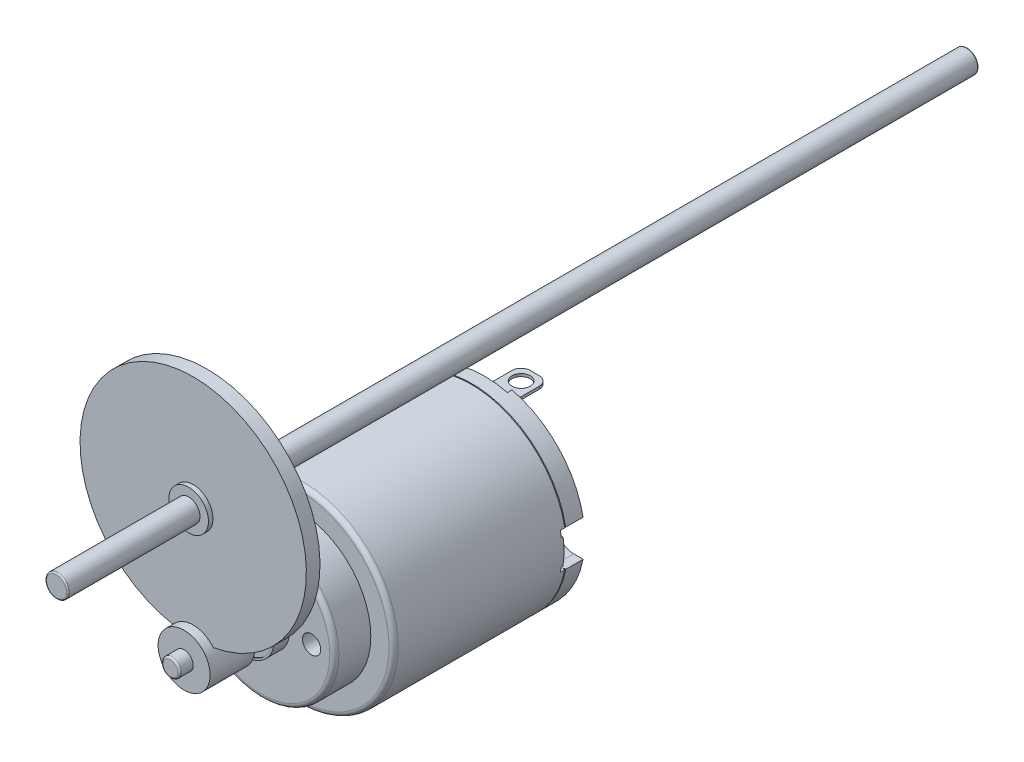
from build123d import *
from build123d.topology import SkipClean

# Parameters (mm, degrees)
ESBO_O1_R                      = 1
RESSALTO_EXTRUS_O1_DEPTH       = 38
ESBO_O2_R                      = 8
RESSALTO_EXTRUS_O2_DEPTH       = 25
ESBO_O3_R                      = 3.075
RESSALTO_EXTRUS_O3_DEPTH       = 1.7
ESBO_O4_R                      = 10.5
RESSALTO_EXTRUS_O4_DEPTH       = 21
ESBO_O5_R                      = 3.125
RESSALTO_EXTRUS_O5_DEPTH       = 2
ESBO_O6_W                      = 3
ESBO_O6_H                      = 0.3
RESSALTO_EXTRUS_O6_DEPTH       = 5
ESBO_O7_R                      = 1
CORTE_EXTRUS_O1_DEPTH          = 4
ESBO_O8_R                      = 1
CORTE_EXTRUS_O2_DEPTH          = 4
FILETE1_R                      = 1
FILETE2_R                      = 0.2
CORTE_EXTRUS_O3_DEPTH          = 15
CORTE_EXTRUS_O3_DEPTH_BACK     = 38
ESBO_O9_R                      = 1
ESBO_O10_W                     = 1.239132447
ESBO_O10_H                     = 9.327126009
CORTE_EXTRUS_O4_DEPTH          = 2
CORTE_EXTRUS_O5_DEPTH          = 0.5
CORTE_EXTRUS_O6_DEPTH          = 2
ESBO_O13_W                     = 3
ESBO_O13_H                     = 0.3
RESSALTO_EXTRUS_O7_DEPTH       = 6
ESBO_O14_R                     = 11.30933102
ESBO_O14_R_2                   = 10.3
CORTE_EXTRUS_O7_DEPTH          = 0.1
FILETE3_R                      = 0.5
ESBO_O15_R                     = 2.875
CORTE_EXTRUS_O8_DEPTH          = 0.1
CORTE_EXTRUS_O9_DEPTH          = 2.5
RESSALTO_EXTRUS_O8_DEPTH       = 0.2
ESBO_O18_R                     = 2.85
RESSALTO_EXTRUS_O9_DEPTH       = 4.9
ESBO_O19_R                     = 12.425
RESSALTO_EXTRUS_O10_DEPTH      = 1.5
ESBO_O20_R                     = 2.175
RESSALTO_EXTRUS_O11_DEPTH      = 2
ESBO_O21_R                     = 2.175
RESSALTO_EXTRUS_O12_DEPTH      = 3.9
CORTE_EXTRUS_O10_DEPTH         = 12
CORTE_EXTRUS_O10_DEPTH_BACK    = 7.9
ESBO_O22_R                     = 1.25
RESSALTO_EXTRUS_O13_DEPTH      = 15
RESSALTO_EXTRUS_O13_DEPTH_BACK = 85
ESBO_O23_R                     = 1.25
FILETE4_R                      = 0.15


with BuildPart() as part:
    # Esboço1 → Ressalto-extrusão1 (new body)
    with BuildSketch(Plane.XY):
        Circle(ESBO_O1_R)
    extrude(amount=RESSALTO_EXTRUS_O1_DEPTH)

    # Esboço2 → Ressalto-extrusão2 (add)
    with BuildSketch(Plane.XY.offset(28)):
        Circle(ESBO_O2_R)
    extrude(amount=-RESSALTO_EXTRUS_O2_DEPTH)

    # Esboço3 → Ressalto-extrusão3 (add)
    with BuildSketch(Plane.XY.offset(28)):
        Circle(ESBO_O3_R)
    extrude(amount=RESSALTO_EXTRUS_O3_DEPTH)

    # Esboço4 → Ressalto-extrusão4 (add)
    with BuildSketch(Plane(origin=(0, 0, 3), x_dir=(-1, 0, 0), z_dir=(0, 0, -1))):
        Circle(ESBO_O4_R)
    extrude(amount=-RESSALTO_EXTRUS_O4_DEPTH)

    # Esboço5 → Ressalto-extrusão5 (add)
    with BuildSketch(Plane(origin=(0, 0, 3), x_dir=(-1, 0, 0), z_dir=(0, 0, -1))):
        Circle(ESBO_O5_R)
    extrude(amount=RESSALTO_EXTRUS_O5_DEPTH)

    # Esboço6 → Ressalto-extrusão6 (add)
    with BuildSketch(Plane(origin=(0, 0, 3), x_dir=(-1, 0, 0), z_dir=(0, 0, -1))):
        with Locations((0, 7.9)):
            Rectangle(ESBO_O6_W, ESBO_O6_H)
        with Locations((0, -7.9)):
            Rectangle(ESBO_O6_W, ESBO_O6_H)
    extrude(amount=RESSALTO_EXTRUS_O6_DEPTH)

    # Esboço7 → Corte-extrusão1 (cut)
    with BuildSketch(Plane(origin=(0, 8.05, 0), x_dir=(1, 0, 0), z_dir=(0, 1, 0))):
        with Locations((0, 0.5)):
            Circle(ESBO_O7_R)
    extrude(amount=-CORTE_EXTRUS_O1_DEPTH, mode=Mode.SUBTRACT)

    # Esboço8 → Corte-extrusão2 (cut)
    with BuildSketch(Plane(origin=(0, -7.75, 0), x_dir=(1, 0, 0), z_dir=(0, 1, 0))):
        with Locations((0, 0.5)):
            Circle(ESBO_O8_R)
    extrude(amount=-CORTE_EXTRUS_O2_DEPTH, mode=Mode.SUBTRACT)

    # Filete1
    filete1_edges = [part.edges().sort_by_distance(p)[0] for p in [
        (1.5, -7.9, -2),
        (-1.5, -7.9, -2),
        (1.5, 7.9, -2),
        (-1.5, 7.9, -2),
    ]]
    fillet(filete1_edges, radius=FILETE1_R)

    # Filete2
    filete2_edges = [part.edges().sort_by_distance(p)[0] for p in [
        (-1, 0, 0),
        (-1, 0, 38),
    ]]
    fillet(filete2_edges, radius=FILETE2_R)

    # Esboço9 → Corte-extrusão3 (cut, two sides: drawn at the far end of the back side and taken through both)
    with BuildSketch(Plane(origin=(0, 0, 3), x_dir=(-1, 0, 0), z_dir=(0, 0, -1)).offset(-CORTE_EXTRUS_O3_DEPTH_BACK)):
        with Locations((-5.5, 0)):
            Circle(ESBO_O9_R)
        with Locations((5.5, 0)):
            Circle(ESBO_O9_R)
    extrude(amount=CORTE_EXTRUS_O3_DEPTH + CORTE_EXTRUS_O3_DEPTH_BACK, mode=Mode.SUBTRACT)

    # Esboço10 → Corte-extrusão4 (cut)
    with BuildSketch(Plane(origin=(0, 0, 1), x_dir=(-1, 0, 0), z_dir=(0, 0, -1))):
        with Locations((3.194566224, -0.245450684)):
            Rectangle(ESBO_O10_W, ESBO_O10_H)
    extrude(amount=-CORTE_EXTRUS_O4_DEPTH, mode=Mode.SUBTRACT)

    # Esboço11 → Corte-extrusão5 (cut)
    with BuildSketch(Plane(origin=(0, 0, 3), x_dir=(-1, 0, 0), z_dir=(0, 0, -1))):
        with BuildLine():
            Line((-3.708099244, 1.5), (-7.348469228, 1.5))
            ThreePointArc((-7.348469228, 1.5), (-5.657498182, 4.923689097), (-2.5, 7.071067812))
            Line((-2.5, 7.071067812), (-2.5, 12.5))
            Line((-2.5, 12.5), (2.5, 12.5))
            Line((2.5, 12.5), (2.5, 7.071067812))
            ThreePointArc((2.5, 7.071067812), (5.657498182, 4.923689097), (7.348469228, 1.5))
            Line((7.348469228, 1.5), (3.708099244, 1.5))
            ThreePointArc((3.708099244, 1.5), (3.208309493, 2.388880532), (2.5, 3.122498999))
            ThreePointArc((2.5, 3.122498999), (-1.011435463, 3.870012701), (-3.708099244, 1.5))
        make_face()
        with BuildLine():
            Line((7.348469228, -1.5), (3.708099244, -1.5))
            ThreePointArc((3.708099244, -1.5), (1.011435463, -3.870012701), (-2.5, -3.122498999))
            ThreePointArc((-2.5, -3.122498999), (-3.208309493, -2.388880532), (-3.708099244, -1.5))
            Line((-3.708099244, -1.5), (-7.348469228, -1.5))
            ThreePointArc((-7.348469228, -1.5), (-5.657498182, -4.923689097), (-2.5, -7.071067812))
            Line((-2.5, -7.071067812), (-2.5, -12.5))
            Line((-2.5, -12.5), (2.5, -12.5))
            Line((2.5, -12.5), (2.5, -7.071067812))
            ThreePointArc((2.5, -7.071067812), (5.657498182, -4.923689097), (7.348469228, -1.5))
        make_face()
    extrude(amount=-CORTE_EXTRUS_O5_DEPTH, mode=Mode.SUBTRACT)


with BuildPart() as corte_extrus_o5_piece_1:
    # of the separate pieces the step leaves, piece 1, a body of its own (corte_extrus_o5_pieces)
    add(part.part.solids().sort_by_distance((1, 0, 0.2))[0])

    # Esboço12 → Corte-extrusão6 (cut)
    with BuildSketch(Plane(origin=(0, 0, 3.5), x_dir=(-1, 0, 0), z_dir=(0, 0, -1))):
        with BuildLine():
            ThreePointArc((3.375, -5.845671476), (4.772970773, -4.772970773), (5.845671476, -3.375))
            ThreePointArc((5.845671476, -3.375), (5.479646072, -2.008974596), (4.113620668, -2.375))
            ThreePointArc((4.113620668, -2.375), (3.358757211, -3.358757211), (2.375, -4.113620668))
            ThreePointArc((2.375, -4.113620668), (2.008974596, -5.479646072), (3.375, -5.845671476))
        make_face()
        with BuildLine():
            ThreePointArc((-3.375, 5.845671476), (-4.772970773, 4.772970773), (-5.845671476, 3.375))
            ThreePointArc((-5.845671476, 3.375), (-5.479646072, 2.008974596), (-4.113620668, 2.375))
            ThreePointArc((-4.113620668, 2.375), (-3.358757211, 3.358757211), (-2.375, 4.113620668))
            ThreePointArc((-2.375, 4.113620668), (-2.008974596, 5.479646072), (-3.375, 5.845671476))
        make_face()
    extrude(amount=-CORTE_EXTRUS_O6_DEPTH, mode=Mode.SUBTRACT)



with BuildPart() as corte_extrus_o5_piece_2:
    # of the separate pieces the step leaves, piece 2, a body of its own (corte_extrus_o5_pieces)
    add(part.part.solids().sort_by_distance((1.5, 8.05, -1))[0])


with BuildPart() as corte_extrus_o5_piece_3:
    # of the separate pieces the step leaves, piece 3, a body of its own (corte_extrus_o5_pieces)
    add(part.part.solids().sort_by_distance((-1.5, -8.05, -1))[0])


with BuildPart() as corte_extrus_o5_piece_1_1:
    add(corte_extrus_o5_piece_1.part)

    add(corte_extrus_o5_piece_2.part)  # Ressalto-extrusão7 merges Corte-extrusão5 piece 2

    add(corte_extrus_o5_piece_3.part)  # Ressalto-extrusão7 merges Corte-extrusão5 piece 3
    # Esboço13 → Ressalto-extrusão7 (add)
    with BuildSketch(Plane.XY.offset(3)):
        with Locations((0, 7.9)):
            Rectangle(ESBO_O13_W, ESBO_O13_H)
        with Locations((0, -7.9)):
            Rectangle(ESBO_O13_W, ESBO_O13_H)
    extrude(amount=RESSALTO_EXTRUS_O7_DEPTH)

    # Esboço14 → Corte-extrusão7 (cut)
    with BuildSketch(Plane(origin=(0, 0, 5), x_dir=(-1, 0, 0), z_dir=(0, 0, -1))):
        Circle(ESBO_O14_R)
        Circle(ESBO_O14_R_2, mode=Mode.SUBTRACT)
    extrude(amount=CORTE_EXTRUS_O7_DEPTH, mode=Mode.SUBTRACT)

    # Filete3
    filete3_edges = [corte_extrus_o5_piece_1_1.edges().sort_by_distance(p)[0] for p in [
        (-8, 0, 28),
        (10.5, 0, 24),
    ]]
    fillet(filete3_edges, radius=FILETE3_R)

    # Esboço15 → Corte-extrusão8 (cut)
    with BuildSketch(Plane.XY.offset(29.7)):
        Circle(ESBO_O15_R)
    extrude(amount=-CORTE_EXTRUS_O8_DEPTH, mode=Mode.SUBTRACT)


with BuildPart() as corte_extrus_o8_piece_1:
    # of the separate pieces the step leaves, piece 1, a body of its own (corte_extrus_o8_pieces)
    add(corte_extrus_o5_piece_1_1.part.solids().sort_by_distance((7.5, 0, 28))[0])

    # Esboço16 → Corte-extrusão9 (cut)
    with BuildSketch(Plane(origin=(0, 0, 3), x_dir=(-1, 0, 0), z_dir=(0, 0, -1))):
        with BuildLine():
            Line((-9.287087811, 2), (-10.307764064, 2))
            ThreePointArc((-10.307764064, 2), (-10.5, 0), (-10.307764064, -2))
            Line((-10.307764064, -2), (-9.287087811, -2))
            ThreePointArc((-9.287087811, -2), (-7.287087811, 0), (-9.287087811, 2))
        make_face()
        with BuildLine():
            Line((10.307764064, 2), (9.287087811, 2))
            ThreePointArc((9.287087811, 2), (7.287087811, 0), (9.287087811, -2))
            Line((9.287087811, -2), (10.307764064, -2))
            ThreePointArc((10.307764064, -2), (10.5, 0), (10.307764064, 2))
        make_face()
    extrude(amount=-CORTE_EXTRUS_O9_DEPTH, mode=Mode.SUBTRACT)

    # Esboço17 → Ressalto-extrusão8 (add)
    with SkipClean():  # the faces are left unmerged after this step: merging them gives an invalid solid
        with BuildSketch(Plane(origin=(0, 0, 5.5), x_dir=(-1, 0, 0), z_dir=(0, 0, -1))):
            with BuildLine():
                Line((-8.395134617, 1.117244286), (-8.597314976, 1.317232401))
                Line((-8.597314976, 1.317232401), (-10.417048469, 1.317232401))
                ThreePointArc((-10.417048469, 1.317232401), (-10.499595037, -0.092217463), (-10.392304845, -1.5))
                Line((-10.392304845, -1.5), (-8.566600265, -1.5))
                Line((-8.566600265, -1.5), (-8.368780624, -1.300011885))
                Line((-8.368780624, -1.300011885), (-8.395134617, 1.117244286))
            make_face()
            with BuildLine():
                ThreePointArc((10.392304845, -1.5), (10.499595037, -0.092217463), (10.417048469, 1.317232401))
                Line((10.417048469, 1.317232401), (8.597314976, 1.317232401))
                Line((8.597314976, 1.317232401), (8.395134617, 1.117244286))
                Line((8.395134617, 1.117244286), (8.368780624, -1.300011885))
                Line((8.368780624, -1.300011885), (8.566600265, -1.5))
                Line((8.566600265, -1.5), (10.392304845, -1.5))
            make_face()
        extrude(amount=RESSALTO_EXTRUS_O8_DEPTH)


with BuildPart() as corte_extrus_o8_piece_2:
    # of the separate pieces the step leaves, piece 2, a body of its own (corte_extrus_o8_pieces)
    add(corte_extrus_o5_piece_1_1.part.solids().sort_by_distance((1, 0, 37.8))[0])

    # Esboço18 → Ressalto-extrusão9 (add)
    with BuildSketch(Plane.XY.offset(36.5)):
        Circle(ESBO_O18_R)
    extrude(amount=-RESSALTO_EXTRUS_O9_DEPTH)

    # Esboço19 → Ressalto-extrusão10 (add)
    with BuildSketch(Plane.XY.offset(35.5)):
        with Locations((0, 14.025)):
            Circle(ESBO_O19_R)
    extrude(amount=-RESSALTO_EXTRUS_O10_DEPTH)

    # Esboço20 → Ressalto-extrusão11 (add)
    with BuildSketch(Plane(origin=(0, 0, 34), x_dir=(-1, 0, 0), z_dir=(0, 0, -1))):
        with Locations((0, 14.025)):
            Circle(ESBO_O20_R)
    extrude(amount=-RESSALTO_EXTRUS_O11_DEPTH)

    # Esboço21 → Ressalto-extrusão12 (add)
    with BuildSketch(Plane.XY.offset(36)):
        with Locations((0, 14.025)):
            Circle(ESBO_O21_R)
    extrude(amount=-RESSALTO_EXTRUS_O12_DEPTH)

    # Esboço22 → Corte-extrusão10 (cut, two sides: drawn at the far end of the back side and taken through both)
    with BuildSketch(Plane(origin=(0, 0, 32.1), x_dir=(-1, 0, 0), z_dir=(0, 0, -1)).offset(-CORTE_EXTRUS_O10_DEPTH_BACK)):
        with Locations((0, 14.025)):
            Circle(ESBO_O22_R)
    extrude(amount=CORTE_EXTRUS_O10_DEPTH + CORTE_EXTRUS_O10_DEPTH_BACK, mode=Mode.SUBTRACT)

    # Esboço23 → Ressalto-extrusão13 (add, two sides: drawn at the far end of the back side and taken through both)
    with BuildSketch(Plane.XY.offset(35.5).offset(-RESSALTO_EXTRUS_O13_DEPTH_BACK)):
        with Locations((0, 14.025)):
            Circle(ESBO_O23_R)
    extrude(amount=RESSALTO_EXTRUS_O13_DEPTH + RESSALTO_EXTRUS_O13_DEPTH_BACK)

    # Filete4
    filete4_edges = [corte_extrus_o8_piece_2.edges().sort_by_distance(p)[0] for p in [
        (-1.25, 14.025, -49.5),
        (-1.25, 14.025, 50.5),
    ]]
    fillet(filete4_edges, radius=FILETE4_R)


solid = Compound([corte_extrus_o8_piece_1.part, corte_extrus_o8_piece_2.part])
